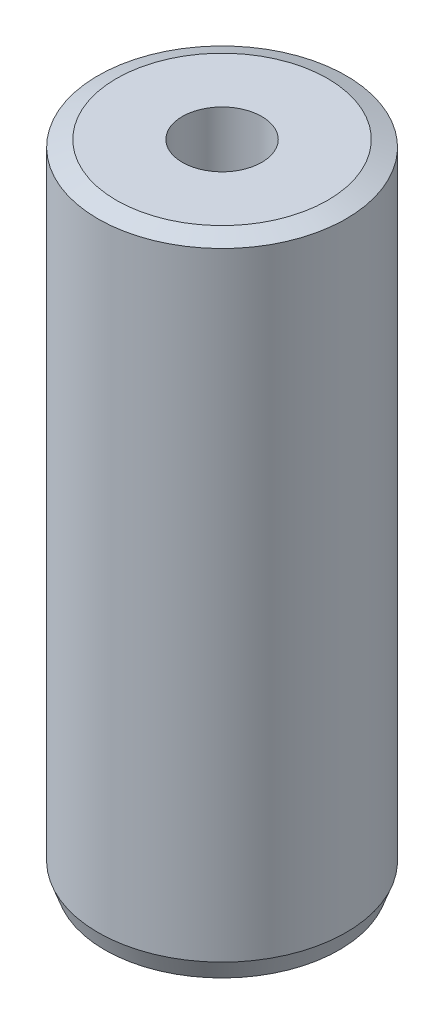
from build123d import *
from OCP.BRepFilletAPI import BRepFilletAPI_MakeChamfer

# Parameters (mm, degrees)
SKETCH1_R           = 12.5
BOSS_EXTRUDE1_DEPTH = 64.810407835
SKETCH2_R           = 4.005089032
CUT_EXTRUDE1_DEPTH  = 68.178039297
CHAMFER1_SIZE       = 0.683437819
CHAMFER1_SIZE2      = 1.863863314


with BuildPart() as part:
    # Sketch1 → Boss-Extrude1 (new body)
    with BuildSketch(Plane(origin=(0, 0, 0), x_dir=(1, 0, 0), z_dir=(0, 1, 0))):
        Circle(SKETCH1_R)
    extrude(amount=BOSS_EXTRUDE1_DEPTH)

    # Sketch2 → Cut-Extrude1 (cut, through all)
    with BuildSketch(Plane(origin=(0, 0, 0), x_dir=(1, 0, 0), z_dir=(0, 1, 0))):
        Circle(SKETCH2_R)
    extrude(amount=CUT_EXTRUDE1_DEPTH, mode=Mode.SUBTRACT)

    # Chamfer1: one chamfer whose edges measure the first distance from different faces: ONE call of the kernel's chamfer builder (chamfer() names one face for all edges)
    chamfer1_edges_1 = [part.edges().sort_by_distance(p)[0] for p in [
        (-12.5, 64.810407835, 0),
    ]]
    chamfer1_side_1 = [part.faces().sort_by_distance(p)[0] for p in [
        (-12.5, 32.405203918, 0),
    ]]
    chamfer1_edges_2 = [part.edges().sort_by_distance(p)[0] for p in [
        (-12.5, 0, 0),
    ]]
    chamfer1_side_2 = [part.faces().sort_by_distance(p)[0] for p in [
        (-12.146446609, 0, 0),
    ]]
    chamfer1 = BRepFilletAPI_MakeChamfer(part.part.solid().wrapped)
    for e in chamfer1_edges_1:
        chamfer1.Add(CHAMFER1_SIZE, CHAMFER1_SIZE2, e.wrapped, chamfer1_side_1[0].wrapped)  # the first distance lies on this face
    for e in chamfer1_edges_2:
        chamfer1.Add(CHAMFER1_SIZE, CHAMFER1_SIZE2, e.wrapped, chamfer1_side_2[0].wrapped)  # the first distance lies on this face
    add(Compound.cast(chamfer1.Shape()), mode=Mode.REPLACE)


solid = part.part
